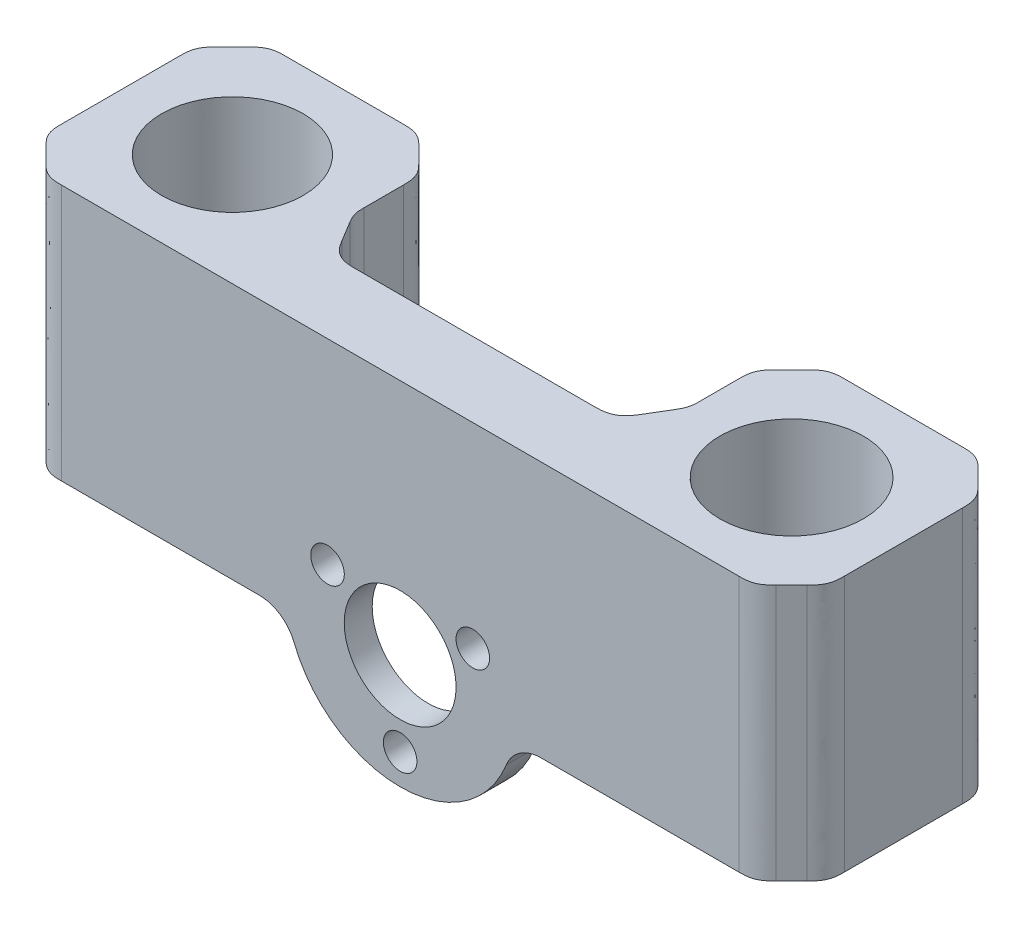
from build123d import *

# Parameters (mm, degrees)
ESQUISSE1_R             = 7.6
BOSS_EXTRU_1_DEPTH      = 25
ESQUISSE3_R             = 7.6
ESQUISSE3_R_2           = 4.4
BOSS_EXTRU_3_DEPTH      = 2.5
BOSS_EXTRU_3_2_DEPTH    = 2.5
BOSS_EXTRU_5_START      = -2.5
ESQUISSE1_4_R           = 7.6
BOSS_EXTRU_5_DEPTH      = 2.5
ESQUISSE7_R             = 12.25
ESQUISSE7_R_2           = 1.8
ESQUISSE7_R_3           = 6
ENL_V_MAT_EXTRU_1_DEPTH = 5
BOSS_EXTRU_9_START      = -3
BOSS_EXTRU_9_DEPTH      = 3
ESQUISSE7_4_R           = 1.8
ENL_V_MAT_EXTRU_2_DEPTH = 52.429563644
ENL_V_START             = -24
ESQUISSE11_R            = 7.6
ESQUISSE11_R_2          = 7.7
ENL_V_MAT_EXTRU_3_DEPTH = 24
CONG_5_R                = 4
CONG_9_R                = 4


with BuildPart() as part:
    # Esquisse1 → Boss.-Extru.1 (new body)
    with BuildSketch(Plane(origin=(0, 0, 0), x_dir=(1, 0, 0), z_dir=(0, 1, 0))):
        Polygon((-26, -12), (26, -12), (38, -12), (42, -8), (42, 0), (42, 8), (38, 12), (22, 12), (18, 8), (18, 1), (15, -4), (-15, -4), (-18, 1), (-18, 8), (-22, 12), (-38, 12), (-42, 8), (-42, 0), (-42, -8), (-38, -12), align=None)
        with Locations(Location((-30, 0, 0), (0, 0, 270))):
            Circle(ESQUISSE1_R, mode=Mode.SUBTRACT)
        with Locations(Location((30, 0, 0), (0, 0, 90))):
            Circle(ESQUISSE1_R, mode=Mode.SUBTRACT)
    extrude(amount=BOSS_EXTRU_1_DEPTH)


with BuildPart() as body_2:
    # Esquisse3 → Boss.-Extru.3 (new body)
    with BuildSketch(Plane.XZ):
        with Locations(Location((-30, 0, 0), (0, 0, 90))):
            Circle(ESQUISSE3_R)
        with Locations(Location((-30, 0, 0), (0, 0, 270))):
            Circle(ESQUISSE3_R_2, mode=Mode.SUBTRACT)
    extrude(amount=BOSS_EXTRU_3_DEPTH)


with BuildPart() as body_3:
    # Esquisse3 → Boss.-Extru.3 2 (new body)
    with BuildSketch(Plane.XZ):
        with Locations(Location((30, 0, 0), (0, 0, 270))):
            Circle(ESQUISSE3_R)
        with Locations(Location((30, 0, 0), (0, 0, 90))):
            Circle(ESQUISSE3_R_2, mode=Mode.SUBTRACT)
    extrude(amount=BOSS_EXTRU_3_2_DEPTH)


with BuildPart() as boss_extru_5_tool:
    # Esquisse1<4> → Boss.-Extru.5 (new body)
    with BuildSketch(Plane(origin=(0, 0, 0), x_dir=(1, 0, 0), z_dir=(0, 1, 0)).offset(BOSS_EXTRU_5_START)):
        Polygon((-26, -12), (26, -12), (38, -12), (42, -8), (42, 0), (42, 8), (38, 12), (22, 12), (18, 8), (18, 1), (15, -4), (-15, -4), (-18, 1), (-18, 8), (-22, 12), (-38, 12), (-42, 8), (-42, 0), (-42, -8), (-38, -12), align=None)
        with Locations(Location((-30, 0, 0), (0, 0, 90))):
            Circle(ESQUISSE1_4_R, mode=Mode.SUBTRACT)
        with Locations(Location((30, 0, 0), (0, 0, 90))):
            Circle(ESQUISSE1_4_R, mode=Mode.SUBTRACT)
    extrude(amount=BOSS_EXTRU_5_DEPTH)


with BuildPart() as part_1:
    add(part.part)


with BuildPart() as part_2:
    # Boss.-Extru.5: joined with boss_extru_5_tool
    add(part_1.part.fuse(boss_extru_5_tool.part, body_2.part, body_3.part, tol=0.00001))

    # Congé1
    # a fillet whose section is not a circle: 4 mm, written as the material it adds along each edge (its section moved 0.00015 mm through the faces so that the kernel can cut it)
    with BuildSketch(Plane(origin=(18, -2.5, -1), x_dir=(-0.5143796574054815, 0, 0.8575625738378626), z_dir=(0, 1, 0)), Plane(origin=(-18, -2.5, -1), x_dir=(-0.0001353868974460592, 0, -0.9999999908351939), z_dir=(0, 1, 0))) as cong_1_piece_1:
        with BuildLine():
            add(Edge.make_bspline([(1.10793587, 0), (0.902493315, 2.7814e-05), (0.69705076, 5.5628e-05), (0.239408615, -0.025477801), (-0.192222234, -0.144969707), (-0.597841789, -0.35842009), (-0.774021637, -0.464095562), (-0.950201485, -0.569771034)], knots=[0, 0, 0, 0, 0, 0, 0.5, 0.5, 1, 1, 1, 1, 1, 1], degree=5))
            Line((-0.950201485, -0.569771034), (-0.991351857, -0.501166028))
            ThreePointArc((-0.991351857, -0.501166028), (-0.516212536, -0.216344828), (-0.041150373, 0.068605006))
            Line((-0.041150373, 0.068605006), (1.0831e-05, 0.079999999))
            ThreePointArc((1.0831e-05, 0.079999999), (0.553978756, 0.079924999), (1.107946701, 0.079999999))
            Line((1.107946701, 0.079999999), (1.10793587, 0))
        make_face()
    extrude(amount=27.5)
    with BuildSketch(Plane(origin=(15, -2.5, 4), x_dir=(-0.9999999978066518, 0, 6.623213906591533e-05), z_dir=(0, 1, 0)), Plane(origin=(-15, -2.5, 4), x_dir=(-0.5145525478897627, 0, -0.857458847677341), z_dir=(0, 1, 0))) as cong_1_piece_2:
        with BuildLine():
            add(Edge.make_bspline([(2.264761521, 0), (1.857786722, 2.6955e-05), (1.450811923, 5.391e-05), (0.542712194, -0.104394528), (-0.189774309, -0.519057275), (-0.746647587, -1.243934331), (-0.956057507, -1.592898474), (-1.165467427, -1.941862617)], knots=[0, 0, 0, 0, 0, 0, 0.5, 0.5, 1, 1, 1, 1, 1, 1], degree=5))
            Line((-1.165467427, -1.941862617), (-1.234064135, -1.900698413))
            ThreePointArc((-1.234064135, -1.900698413), (-0.651266112, -0.929805696), (-0.068596708, 0.041164204))
            Line((-0.068596708, 0.041164204), (5.299e-06, 0.08))
            ThreePointArc((5.299e-06, 0.08), (1.132386054, 0.079925), (2.264766819, 0.08))
            Line((2.264766819, 0.08), (2.264761521, 0))
        make_face()
    extrude(amount=27.5)
    # a fillet whose section is not a circle: 4 mm, written as the material it takes off along each edge (its section moved 0.00015 mm through the faces so that the kernel can cut it)
    with BuildSketch(Plane(origin=(-42, 29.142135641, 8), x_dir=(0.7070427617847125, 0, 0.7071707947927759), z_dir=(0, -1, 0)), Plane(origin=(-42, 29.142135641, -8), x_dir=(-9.053300821669349e-05, 0, 0.9999999959018872), z_dir=(0, -1, 0)), Plane(origin=(-38, 29.142135641, 12), x_dir=(0.9999999959018872, 0, 9.053300821776541e-05), z_dir=(0, -1, 0)), Plane(origin=(38, -6.642135641, 12), x_dir=(-0.9999999959018872, 0, 9.053300821776541e-05), z_dir=(0, 1, 0)), Plane(origin=(42, -6.642135641, 8), x_dir=(-0.707042761784713, 0, 0.7071707947927753), z_dir=(0, 1, 0))) as cong_1_2_piece_1:
        with BuildLine():
            add(Edge.make_bspline([(1.656854256, 0), (1.353557685, 2.7458e-05), (1.050261114, 5.4917e-05), (0.373621537, -0.056813552), (-0.22407218, -0.304323003), (-0.742820036, -0.742473436), (-0.957302515, -0.956917083), (-1.171784993, -1.171360729)], knots=[0, 0, 0, 0, 0, 0, 0.5, 0.5, 1, 1, 1, 1, 1, 1], degree=5))
            Line((-1.171784993, -1.171360729), (-1.228348414, -1.114787065))
            ThreePointArc((-1.228348414, -1.114787065), (-0.642402889, -0.529159739), (-0.056563421, 0.056573664))
            Line((-0.056563421, 0.056573664), (7.243e-06, 0.08))
            ThreePointArc((7.243e-06, 0.08), (0.828434364, 0.079925), (1.656861499, 0.08))
            Line((1.656861499, 0.08), (1.656854256, 0))
        make_face()
    extrude(amount=35.784271281, mode=Mode.SUBTRACT)
    with BuildSketch(Plane(origin=(-38, -6.642135641, -12), x_dir=(-0.7071707947927749, 0, 0.7070427617847136), z_dir=(0, 1, 0)), Plane(origin=(-22, -6.642135641, -12), x_dir=(-0.9999999959018872, 0, -9.053300821776562e-05), z_dir=(0, 1, 0)), Plane(origin=(-18, -6.642135641, -8), x_dir=(-0.7070427617847114, 0, -0.7071707947927769), z_dir=(0, 1, 0)), Plane(origin=(42, -6.642135641, -8), x_dir=(-0.707042761784714, 0, -0.7071707947927742), z_dir=(0, 1, 0)), Plane(origin=(38, -6.642135641, -12), x_dir=(-0.9999999959018872, 0, -9.05330082177658e-05), z_dir=(0, 1, 0)), Plane(origin=(22, -6.642135641, -12), x_dir=(-0.7071707947927742, 0, 0.707042761784714), z_dir=(0, 1, 0)), Plane(origin=(18, -6.642135641, -8), x_dir=(-9.053300821883819e-05, 0, 0.9999999959018873), z_dir=(0, 1, 0))) as cong_1_2_piece_2:
        with BuildLine():
            add(Edge.make_bspline([(1.656854256, 0), (1.353557685, -2.7458e-05), (1.050261114, -5.4917e-05), (0.373621537, 0.056813552), (-0.22407218, 0.304323003), (-0.742820036, 0.742473436), (-0.957302515, 0.956917083), (-1.171784993, 1.171360729)], knots=[0, 0, 0, 0, 0, 0, 0.5, 0.5, 1, 1, 1, 1, 1, 1], degree=5))
            Line((-1.171784993, 1.171360729), (-1.228348414, 1.114787065))
            ThreePointArc((-1.228348414, 1.114787065), (-0.642402889, 0.529159739), (-0.056563421, -0.056573664))
            Line((-0.056563421, -0.056573664), (7.243e-06, -0.08))
            ThreePointArc((7.243e-06, -0.08), (0.828434364, -0.079925), (1.656861499, -0.08))
            Line((1.656861499, -0.08), (1.656854256, 0))
        make_face()
    extrude(amount=35.784271281, mode=Mode.SUBTRACT)

    # Esquisse7 → Enlèv. mat.-Extru.1 (cut)
    with BuildSketch(Plane(origin=(0, 0, 4), x_dir=(-1, 0, 0), z_dir=(0, 0, -1))):
        with Locations((0, -0.5)):
            Circle(ESQUISSE7_R)
        with Locations((-7.794228634, 4)):
            Circle(ESQUISSE7_R_2, mode=Mode.SUBTRACT)
        with Locations((7.794228634, 4)):
            Circle(ESQUISSE7_R_2, mode=Mode.SUBTRACT)
        with Locations((0, -9.5)):
            Circle(ESQUISSE7_R_2, mode=Mode.SUBTRACT)
        with Locations((0, -0.5)):
            Circle(ESQUISSE7_R_3, mode=Mode.SUBTRACT)
    extrude(amount=-ENL_V_MAT_EXTRU_1_DEPTH, mode=Mode.SUBTRACT)

    # Esquisse10 → Boss.-Extru.9 (add)
    with BuildSketch(Plane.XY.offset(12).offset(BOSS_EXTRU_9_START)):
        with BuildLine():
            Line((12.085631965, -2.5), (-12.085631965, -2.5))
            ThreePointArc((-12.085631965, -2.5), (0, -12.75), (12.085631965, -2.5))
        make_face()
    extrude(amount=BOSS_EXTRU_9_DEPTH)

    # Esquisse7<4> → Enlèv. mat.-Extru.2 (cut, through all)
    with BuildSketch(Plane(origin=(0, 0, 4), x_dir=(-1, 0, 0), z_dir=(0, 0, -1))):
        with Locations((0, -9.5)):
            Circle(ESQUISSE7_4_R)
        with Locations((-7.794228634, 4)):
            Circle(ESQUISSE7_4_R)
        with Locations((7.794228634, 4)):
            Circle(ESQUISSE7_4_R)
        with BuildLine():
            Line((5.656854249, -2.5), (-5.656854249, -2.5))
            ThreePointArc((-5.656854249, -2.5), (0, -6.5), (5.656854249, -2.5))
        make_face()
        with BuildLine():
            ThreePointArc((6, -0.5), (-1.014611872, 5.413591358), (-5.656854249, -2.5))
            Line((-5.656854249, -2.5), (5.656854249, -2.5))
            ThreePointArc((5.656854249, -2.5), (5.913591358, -1.514611872), (6, -0.5))
        make_face()
    extrude(amount=-ENL_V_MAT_EXTRU_2_DEPTH, mode=Mode.SUBTRACT)

    # Esquisse11 → Enlèv. mat.-Extru.3 (cut)
    with BuildSketch(Plane(origin=(0, 25, 0), x_dir=(1, 0, 0), z_dir=(0, 1, 0)).offset(ENL_V_START)):
        with Locations(Location((-30, 0, 0), (0, 0, 90))):
            Circle(ESQUISSE11_R)
        with Locations(Location((30, 0, 0), (0, 0, 270))):
            Circle(ESQUISSE11_R_2)
    extrude(amount=ENL_V_MAT_EXTRU_3_DEPTH, mode=Mode.SUBTRACT)

    # Congé5
    cong_5_edges = [part_2.edges().sort_by_distance(p)[0] for p in [
        (-12.085631965, -2.5, 10.5),
        (12.085631965, -2.5, 10.5),
    ]]
    fillet(cong_5_edges, radius=CONG_5_R)

    # Congé9
    # the kernel refuses this fillet: 4 mm, written as the material it takes off along each edge
    with BuildSketch(Plane(origin=(-12.085631965, -2.5, 9), x_dir=(-0.02030344534448464, 0.9997938638075068, 0), z_dir=(0, 0, -1))) as cong_9_piece_1:
        with BuildLine():
            CenterArc((4.081218053, -3.958774717), CONG_9_R, 98.23309571, 82.930285958)
            Line((0.082042598, -4.039988498), (0, 0))
            ThreePointArc((0, 0), (1.75420776, -0.12625243), (3.508415519, 0))
        make_face()
    extrude(amount=15.102053644, mode=Mode.SUBTRACT)


solid = part_2.part
